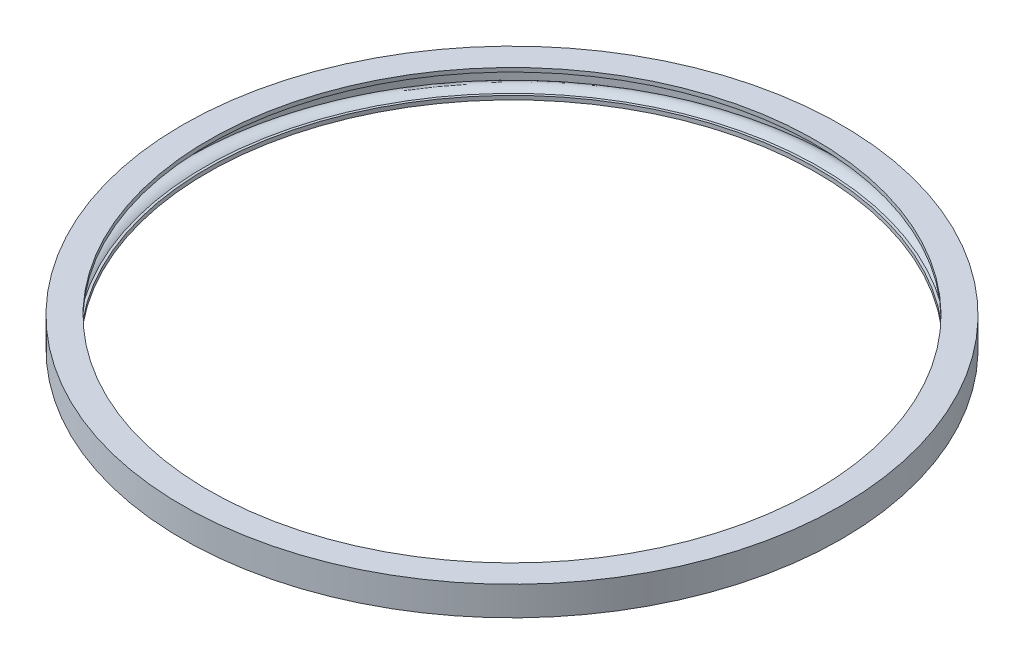
from build123d import *


with BuildPart() as part:
    # Sketch2 → Revolve1 (revolve)
    with BuildSketch(Plane(origin=(19.120852059, -36.752173782, 65.570618184), x_dir=(-0.9800835557204909, -4.980770021259261e-15, -0.1985855578995605), z_dir=(0.1985855578995605, 2.571409064264252e-15, -0.9800835557204909))):
        with BuildLine():
            ThreePointArc((-263.332584066, 5.221571347), (-258.227186422, 6.173270114), (-253.807584066, 8.900527101))
            Line((-253.807584066, 8.900527101), (-253.807584066, 7.161851411))
            Line((-253.807584066, 7.161851411), (-249.807584066, 7.161851411))
            Line((-249.807584066, 7.161851411), (-249.807584066, 11.221571347))
            Line((-249.807584066, 11.221571347), (-276.857584066, 11.221571347))
            Line((-276.857584066, 11.221571347), (-276.857584066, -18.820517146))
            Line((-276.857584066, -18.820517146), (-251.278247656, -18.820517146))
            Line((-251.278247656, -18.820517146), (-251.278247656, -14.76079721))
            Line((-251.278247656, -14.76079721), (-253.807584066, -14.76079721))
            Line((-253.807584066, -14.76079721), (-253.807584066, -16.499472899))
            ThreePointArc((-253.807584066, -16.499472899), (-258.227186422, -13.772215913), (-263.332584066, -12.820517146))
            ThreePointArc((-263.332584066, -12.820517146), (-268.437981711, -13.772215913), (-272.857584066, -16.499472899))
            Line((-272.857584066, -16.499472899), (-272.857584066, 8.900527101))
            ThreePointArc((-272.857584066, 8.900527101), (-268.437981711, 6.173270114), (-263.332584066, 5.221571347))
        make_face()
    revolve(axis=Axis((-43.303037422, -31.530602434, 52.922224232), (0, 1, 0)))


solid = part.part
